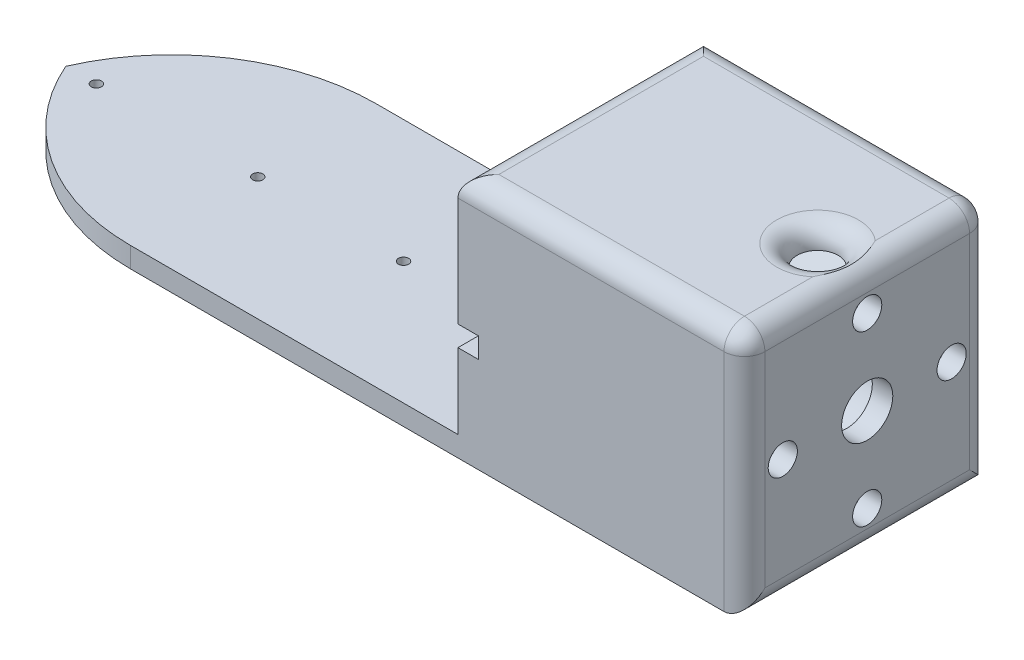
from build123d import *

# Parameters (mm, degrees)
SKETCH1_W            = 24
SKETCH1_H            = 24
BOSS_EXTRUDE6_DEPTH  = 28
SHELL6_T             = -2
SKETCH4_R            = 1.425
SKETCH4_R_2          = 2.5
CUT_EXTRUDE2_DEPTH   = 2
BOSS_EXTRUDE12_DEPTH = 15
SKETCH5_R            = 2
CUT_EXTRUDE4_DEPTH   = 10
SKETCH8_W            = 24
SKETCH8_H            = 1.989951349
BOSS_EXTRUDE13_DEPTH = 52
FILLET1_R            = 20
SKETCH12_R           = 0.5
SKETCH12_R_2         = 0.501124618
CUT_EXTRUDE5_DEPTH   = 2
SKETCH15_W           = 2
SKETCH15_H           = 2
CUT_EXTRUDE8_DEPTH   = 72.527001046
FILLET3_R            = 2


with BuildPart() as part:
    # Sketch1 → Boss-Extrude6 (new body)
    with BuildSketch(Plane.ZY.offset(-56.210288662)):
        with Locations((20.620192101, 25.155286665)):
            Rectangle(SKETCH1_W, SKETCH1_H)
    extrude(amount=BOSS_EXTRUDE6_DEPTH)

    # Shell6
    shell6_openings = [part.faces().sort_by_distance(p)[0] for p in [
        (28.210288662, 25.155286665, 20.620192101),
    ]]
    offset(amount=SHELL6_T, openings=shell6_openings, kind=Kind.INTERSECTION)

    # Sketch4 → Cut-Extrude2 (cut)
    with BuildSketch(Plane(origin=(56.210288662, 25.155286665, 20.620192101), x_dir=(0, 0, -1), z_dir=(1, 0, 0))):
        with Locations((0, -8.25)):
            Circle(SKETCH4_R)
        with Locations((8.25, 0)):
            Circle(SKETCH4_R)
        with Locations((0, 8.25)):
            Circle(SKETCH4_R)
        with Locations((-8.25, 0)):
            Circle(SKETCH4_R)
        Circle(SKETCH4_R_2)
    extrude(amount=-CUT_EXTRUDE2_DEPTH, mode=Mode.SUBTRACT)

    # Sketch7 → Boss-Extrude12 (add)
    with BuildSketch(Plane.ZY.offset(-54.210288662)):
        with BuildLine():
            Line((24.862832788, 20.912645978), (30.620192101, 15.155286665))
            Line((30.620192101, 15.155286665), (30.620192101, 17.155286665))
            Line((30.620192101, 17.155286665), (25.743297726, 22.032181039))
            ThreePointArc((25.743297726, 22.032181039), (25.336402517, 21.446195225), (24.862832788, 20.912645978))
        make_face()
        with BuildLine():
            Line((28.620192101, 15.155286665), (30.620192101, 15.155286665))
            Line((30.620192101, 15.155286665), (24.862832788, 20.912645978))
            ThreePointArc((24.862832788, 20.912645978), (24.329283541, 20.439076249), (23.743297726, 20.032181039))
            Line((23.743297726, 20.032181039), (28.620192101, 15.155286665))
        make_face()
        with BuildLine():
            Line((10.620192101, 15.155286665), (12.620192101, 15.155286665))
            Line((12.620192101, 15.155286665), (17.497086475, 20.032181039))
            ThreePointArc((17.497086475, 20.032181039), (16.91110066, 20.439076249), (16.377551414, 20.912645978))
            Line((16.377551414, 20.912645978), (10.620192101, 15.155286665))
        make_face()
        with BuildLine():
            Line((10.620192101, 17.155286665), (10.620192101, 15.155286665))
            Line((10.620192101, 15.155286665), (16.377551414, 20.912645978))
            ThreePointArc((16.377551414, 20.912645978), (15.903981685, 21.446195225), (15.497086475, 22.032181039))
            Line((15.497086475, 22.032181039), (10.620192101, 17.155286665))
        make_face()
        with BuildLine():
            Line((10.620192101, 35.155286665), (10.620192101, 33.155286665))
            Line((10.620192101, 33.155286665), (15.497086475, 28.278392291))
            ThreePointArc((15.497086475, 28.278392291), (15.903981685, 28.864378105), (16.377551414, 29.397927352))
            Line((16.377551414, 29.397927352), (10.620192101, 35.155286665))
        make_face()
        with BuildLine():
            Line((17.497086475, 30.278392291), (12.620192101, 35.155286665))
            Line((12.620192101, 35.155286665), (10.620192101, 35.155286665))
            Line((10.620192101, 35.155286665), (16.377551414, 29.397927352))
            ThreePointArc((16.377551414, 29.397927352), (16.91110066, 29.871497081), (17.497086475, 30.278392291))
        make_face()
        with BuildLine():
            Line((24.862832788, 29.397927352), (30.620192101, 35.155286665))
            Line((30.620192101, 35.155286665), (28.620192101, 35.155286665))
            Line((28.620192101, 35.155286665), (23.743297726, 30.278392291))
            ThreePointArc((23.743297726, 30.278392291), (24.329283541, 29.871497081), (24.862832788, 29.397927352))
        make_face()
        with BuildLine():
            Line((25.743297726, 28.278392291), (30.620192101, 33.155286665))
            Line((30.620192101, 33.155286665), (30.620192101, 35.155286665))
            Line((30.620192101, 35.155286665), (24.862832788, 29.397927352))
            ThreePointArc((24.862832788, 29.397927352), (25.336402517, 28.864378105), (25.743297726, 28.278392291))
        make_face()
        with BuildLine():
            Line((22.265943412, 28.801037976), (23.743297726, 30.278392291))
            ThreePointArc((23.743297726, 30.278392291), (20.620192101, 31.155286665), (17.497086475, 30.278392291))
            Line((17.497086475, 30.278392291), (18.97444079, 28.801037976))
            ThreePointArc((18.97444079, 28.801037976), (20.620192101, 29.155286665), (22.265943412, 28.801037976))
        make_face()
        with BuildLine():
            ThreePointArc((15.497086475, 22.032181039), (15.903981685, 21.446195225), (16.377551414, 20.912645978))
            Line((16.377551414, 20.912645978), (17.791764976, 22.32685954))
            ThreePointArc((17.791764976, 22.32685954), (17.329534549, 22.881177416), (16.97444079, 23.509535354))
            Line((16.97444079, 23.509535354), (15.497086475, 22.032181039))
        make_face()
        with BuildLine():
            Line((23.448619226, 27.98371379), (24.862832788, 29.397927352))
            ThreePointArc((24.862832788, 29.397927352), (24.329283541, 29.871497081), (23.743297726, 30.278392291))
            Line((23.743297726, 30.278392291), (22.265943412, 28.801037976))
            ThreePointArc((22.265943412, 28.801037976), (22.89430135, 28.445944217), (23.448619226, 27.98371379))
        make_face()
        with BuildLine():
            ThreePointArc((16.377551414, 20.912645978), (16.91110066, 20.439076249), (17.497086475, 20.032181039))
            Line((17.497086475, 20.032181039), (18.97444079, 21.509535354))
            ThreePointArc((18.97444079, 21.509535354), (18.346082852, 21.864629113), (17.791764976, 22.32685954))
            Line((17.791764976, 22.32685954), (16.377551414, 20.912645978))
        make_face()
        with BuildLine():
            Line((24.265943412, 26.801037976), (25.743297726, 28.278392291))
            ThreePointArc((25.743297726, 28.278392291), (25.336402517, 28.864378105), (24.862832788, 29.397927352))
            Line((24.862832788, 29.397927352), (23.448619226, 27.98371379))
            ThreePointArc((23.448619226, 27.98371379), (23.910849653, 27.429395914), (24.265943412, 26.801037976))
        make_face()
        with BuildLine():
            Line((24.265943412, 23.509535354), (25.743297726, 22.032181039))
            ThreePointArc((25.743297726, 22.032181039), (26.396810218, 23.533348589), (26.620192101, 25.155286665))
            ThreePointArc((26.620192101, 25.155286665), (26.396810218, 26.777224741), (25.743297726, 28.278392291))
            Line((25.743297726, 28.278392291), (24.265943412, 26.801037976))
            ThreePointArc((24.265943412, 26.801037976), (24.530627195, 25.997009528), (24.620192101, 25.155286665))
            ThreePointArc((24.620192101, 25.155286665), (24.530627195, 24.313563802), (24.265943412, 23.509535354))
        make_face()
        with BuildLine():
            Line((23.448619226, 22.32685954), (24.862832788, 20.912645978))
            ThreePointArc((24.862832788, 20.912645978), (25.336402517, 21.446195225), (25.743297726, 22.032181039))
            Line((25.743297726, 22.032181039), (24.265943412, 23.509535354))
            ThreePointArc((24.265943412, 23.509535354), (23.910849653, 22.881177416), (23.448619226, 22.32685954))
        make_face()
        with BuildLine():
            Line((16.377551414, 29.397927352), (17.791764976, 27.98371379))
            ThreePointArc((17.791764976, 27.98371379), (18.346082852, 28.445944217), (18.97444079, 28.801037976))
            Line((18.97444079, 28.801037976), (17.497086475, 30.278392291))
            ThreePointArc((17.497086475, 30.278392291), (16.91110066, 29.871497081), (16.377551414, 29.397927352))
        make_face()
        with BuildLine():
            ThreePointArc((23.743297726, 20.032181039), (24.329283541, 20.439076249), (24.862832788, 20.912645978))
            Line((24.862832788, 20.912645978), (23.448619226, 22.32685954))
            ThreePointArc((23.448619226, 22.32685954), (22.89430135, 21.864629113), (22.265943412, 21.509535354))
            Line((22.265943412, 21.509535354), (23.743297726, 20.032181039))
        make_face()
        with BuildLine():
            ThreePointArc((16.97444079, 26.801037976), (17.329534549, 27.429395914), (17.791764976, 27.98371379))
            Line((17.791764976, 27.98371379), (16.377551414, 29.397927352))
            ThreePointArc((16.377551414, 29.397927352), (15.903981685, 28.864378105), (15.497086475, 28.278392291))
            Line((15.497086475, 28.278392291), (16.97444079, 26.801037976))
        make_face()
        with BuildLine():
            ThreePointArc((17.497086475, 20.032181039), (20.620192101, 19.155286665), (23.743297726, 20.032181039))
            Line((23.743297726, 20.032181039), (22.265943412, 21.509535354))
            ThreePointArc((22.265943412, 21.509535354), (20.620192101, 21.155286665), (18.97444079, 21.509535354))
            Line((18.97444079, 21.509535354), (17.497086475, 20.032181039))
        make_face()
        with BuildLine():
            ThreePointArc((15.497086475, 28.278392291), (14.620192101, 25.155286665), (15.497086475, 22.032181039))
            Line((15.497086475, 22.032181039), (16.97444079, 23.509535354))
            ThreePointArc((16.97444079, 23.509535354), (16.620192101, 25.155286665), (16.97444079, 26.801037976))
            Line((16.97444079, 26.801037976), (15.497086475, 28.278392291))
        make_face()
    extrude(amount=BOSS_EXTRUDE12_DEPTH)

    # Sketch5 → Cut-Extrude4 (cut)
    with BuildSketch(Plane(origin=(0, 37.155286665, 0), x_dir=(1, 0, 0), z_dir=(0, 1, 0))):
        with Locations(Location((51.632262187, -20.888456892, 0), (0, 0, 270))):
            Circle(SKETCH5_R)
    extrude(amount=-CUT_EXTRUDE4_DEPTH, mode=Mode.SUBTRACT)

    # Sketch8 → Boss-Extrude13 (add)
    with BuildSketch(Plane.ZY.offset(-28.210288662)):
        with Locations((20.620192101, 14.150262339)):
            Rectangle(SKETCH8_W, SKETCH8_H)
    extrude(amount=BOSS_EXTRUDE13_DEPTH)

    # Fillet1
    # the kernel refuses this fillet: 20 mm, written as the material it takes off along each edge
    with BuildSketch(Plane(origin=(-23.789711338, 65.145238014, 8.620192101), x_dir=(0, 0, 1), z_dir=(0, -1, 0))) as fillet1_piece_1:
        with BuildLine():
            CenterArc((FILLET1_R, -FILLET1_R), FILLET1_R, 90, 90)
            Line((0, -FILLET1_R), (0, 0))
            Line((0, 0), (FILLET1_R, 0))
        make_face()
    extrude(amount=101.989951349, mode=Mode.SUBTRACT)
    with BuildSketch(Plane(origin=(-23.789711338, -36.844713335, 32.620192101), x_dir=(1, 0, 0), z_dir=(0, 1, 0))) as fillet1_piece_2:
        with BuildLine():
            CenterArc((FILLET1_R, FILLET1_R), FILLET1_R, 180, 90)
            Line((0, FILLET1_R), (0, 0))
            Line((0, 0), (FILLET1_R, 0))
        make_face()
    extrude(amount=101.989951349, mode=Mode.SUBTRACT)

    # Sketch12 → Cut-Extrude5 (cut)
    with BuildSketch(Plane(origin=(0, 15.145238014, 0), x_dir=(1, 0, 0), z_dir=(0, 1, 0))):
        with Locations(Location((-3.377772721, -20.597275642, 0), (0, 0, 180))):
            Circle(SKETCH12_R)
        with Locations(Location((-19.129616691, -20.617828064, 0), (0, 0, 180))):
            Circle(SKETCH12_R)
        with Locations(Location((10.8879759, -20.617828064, 0), (0, 0, 180))):
            Circle(SKETCH12_R_2)
        with Locations(Location((24.75459638, -20.617828064, 0), (0, 0, 180))):
            Circle(SKETCH12_R)
    extrude(amount=-CUT_EXTRUDE5_DEPTH, mode=Mode.SUBTRACT)

    # Sketch15 → Cut-Extrude8 (cut, through all)
    with BuildSketch(Plane.XY.offset(32.620192101)):
        with Locations((29.210288662, 23.495238014)):
            Rectangle(SKETCH15_W, SKETCH15_H)
    extrude(amount=-CUT_EXTRUDE8_DEPTH, mode=Mode.SUBTRACT)

    # Fillet3
    # the kernel refuses this fillet: 2 mm, written as the material it takes off along each edge
    with BuildSketch(Plane(origin=(54.210288662, 35.155286665, 10.620192101), x_dir=(0, 0, -1), z_dir=(0, 1, 0))) as fillet3_piece_1_section:
        Polygon((0, 0), (FILLET3_R, 0), (FILLET3_R, -FILLET3_R), (0, -FILLET3_R), align=None)
    fillet3_piece_1 = extrude(amount=FILLET3_R, mode=Mode.PRIVATE)
    fillet3_piece_1 = fillet3_piece_1 - Plane(origin=(54.210288662, 35.155286665, 10.620192101), x_dir=(-0.7071067811865352, 0, 0.7071067811865597), z_dir=(0, 1, 0)) * Sphere(FILLET3_R, mode=Mode.PRIVATE)
    add(fillet3_piece_1, mode=Mode.SUBTRACT)
    with BuildSketch(Plane(origin=(54.210288662, 35.155286665, 30.620192101), x_dir=(1, 0, 0), z_dir=(0, 1, 0))) as fillet3_piece_2_section:
        Polygon((0, 0), (FILLET3_R, 0), (FILLET3_R, -FILLET3_R), (0, -FILLET3_R), align=None)
    fillet3_piece_2 = extrude(amount=FILLET3_R, mode=Mode.PRIVATE)
    fillet3_piece_2 = fillet3_piece_2 - Plane(origin=(54.210288662, 35.155286665, 30.620192101), x_dir=(-0.7071067811865597, 0, -0.7071067811865352), z_dir=(0, 1, 0)) * Sphere(FILLET3_R, mode=Mode.PRIVATE)
    add(fillet3_piece_2, mode=Mode.SUBTRACT)
    with BuildSketch(Plane(origin=(51.632262187, 37.155286665, 20.888456892), x_dir=(0, 0, 1), z_dir=(-1, 0, 0))) as fillet3_piece_3:
        with BuildLine():
            CenterArc((2 + FILLET3_R, -FILLET3_R), FILLET3_R, 90, 90)
            Line((2, -FILLET3_R), (2, 0))
            Line((2, 0), (2 + FILLET3_R, 0))
        make_face()
    revolve(axis=Axis((51.632262187, 37.155286665, 20.888456892), (0, 1, 0)), mode=Mode.SUBTRACT)
    with BuildSketch(Plane(origin=(28.210288662, 37.155286665, 3.620192101), x_dir=(1, 0, 0), z_dir=(0, 0, 1)), Plane(origin=(56.210288662, 13.155286665, 37.620192101), x_dir=(0, 1, 0), z_dir=(0, 0, -1))) as fillet3_piece_4:
        with BuildLine():
            CenterArc((FILLET3_R, -FILLET3_R), FILLET3_R, 90, 90)
            Line((0, -FILLET3_R), (0, 0))
            Line((0, 0), (FILLET3_R, 0))
        make_face()
    extrude(amount=34, mode=Mode.SUBTRACT)
    with BuildSketch(Plane(origin=(56.210288662, 37.155286665, 10.620192101), x_dir=(-1, 0, 0), z_dir=(0, 0, 1))) as fillet3_piece_5:
        with BuildLine():
            CenterArc((FILLET3_R, FILLET3_R), FILLET3_R, 180, 90)
            Line((0, FILLET3_R), (0, 0))
            Line((0, 0), (FILLET3_R, 0))
        make_face()
    extrude(amount=20, mode=Mode.SUBTRACT)
    with BuildSketch(Plane(origin=(56.210288662, 35.155286665, 32.620192101), x_dir=(0, 0, -1), z_dir=(0, -1, 0))) as fillet3_piece_6:
        with BuildLine():
            CenterArc((FILLET3_R, -FILLET3_R), FILLET3_R, 90, 90)
            Line((0, -FILLET3_R), (0, 0))
            Line((0, 0), (FILLET3_R, 0))
        make_face()
    extrude(amount=27, mode=Mode.SUBTRACT)
    with BuildSketch(Plane(origin=(56.210288662, 8.155286665, 8.620192101), x_dir=(-1, 0, 0), z_dir=(0, 1, 0))) as fillet3_piece_7:
        with BuildLine():
            CenterArc((FILLET3_R, FILLET3_R), FILLET3_R, 180, 90)
            Line((0, FILLET3_R), (0, 0))
            Line((0, 0), (FILLET3_R, 0))
        make_face()
    extrude(amount=27, mode=Mode.SUBTRACT)
    with BuildSketch(Plane(origin=(54.210288662, 37.155286665, 8.620192101), x_dir=(0, 0, 1), z_dir=(-1, 0, 0))) as fillet3_piece_8:
        with BuildLine():
            CenterArc((FILLET3_R, -FILLET3_R), FILLET3_R, 90, 90)
            Line((0, -FILLET3_R), (0, 0))
            Line((0, 0), (FILLET3_R, 0))
        make_face()
    extrude(amount=31, mode=Mode.SUBTRACT)
    with BuildSketch(Plane(origin=(54.210288662, 37.155286665, 32.620192101), x_dir=(0, 0, -1), z_dir=(-1, 0, 0))) as fillet3_piece_9:
        with BuildLine():
            CenterArc((FILLET3_R, FILLET3_R), FILLET3_R, 180, 90)
            Line((0, FILLET3_R), (0, 0))
            Line((0, 0), (FILLET3_R, 0))
        make_face()
    extrude(amount=31, mode=Mode.SUBTRACT)


solid = part.part
